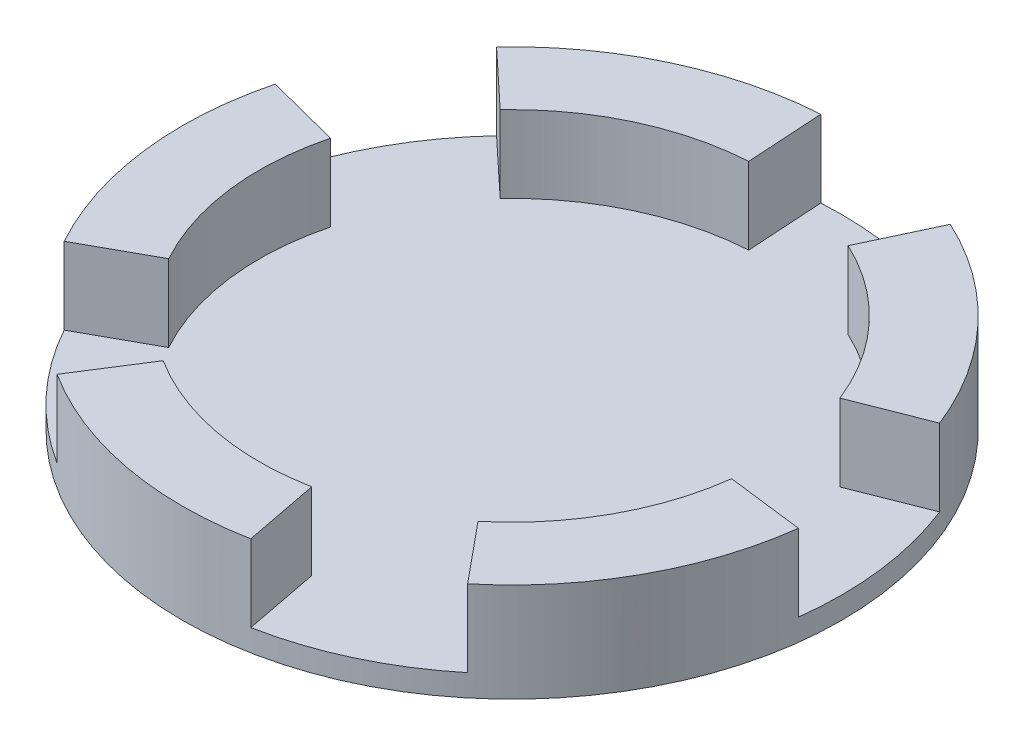
from build123d import *

# Parameters (mm, degrees)
SKETCH1_R           = 5
BOSS_EXTRUDE1_DEPTH = 7.75
SKETCH2_R           = 5
BOSS_EXTRUDE2_DEPTH = 5
SKETCH3_R           = 30
BOSS_EXTRUDE3_DEPTH = 2
FILLET1_R           = 6
BOSS_EXTRUDE4_DEPTH = 7
BOSS_EXTRUDE5_REACH = 49.677


with BuildPart() as part:
    # Sketch1 → Boss-Extrude1 (new body)
    with BuildSketch(Plane(origin=(0, 0, 0), x_dir=(1, 0, 0), z_dir=(0, 1, 0))):
        Circle(SKETCH1_R)
        with BuildLine():
            Line((-1.770593121, 2.575), (1.770593121, 2.575))
            ThreePointArc((1.770593121, 2.575), (0, -3.125), (-1.770593121, 2.575))
        make_face(mode=Mode.SUBTRACT)
    extrude(amount=BOSS_EXTRUDE1_DEPTH)

    # Sketch2 → Boss-Extrude2 (add)
    with BuildSketch(Plane(origin=(0, 7.75, 0), x_dir=(1, 0, 0), z_dir=(0, 1, 0))):
        Circle(SKETCH2_R)
    extrude(amount=BOSS_EXTRUDE2_DEPTH)

    # Sketch3 → Boss-Extrude3 (add)
    with BuildSketch(Plane(origin=(0, 12.75, 0), x_dir=(1, 0, 0), z_dir=(0, 1, 0))):
        Circle(SKETCH3_R)
    extrude(amount=BOSS_EXTRUDE3_DEPTH)

    # Fillet1
    fillet1_edges = [part.edges().sort_by_distance(p)[0] for p in [
        (-5, 12.75, 0),
    ]]
    fillet(fillet1_edges, radius=FILLET1_R)

    # Sketch4 → Boss-Extrude4 (add)
    with BuildSketch(Plane(origin=(0, 14.75, 0), x_dir=(1, 0, 0), z_dir=(0, 1, 0))):
        with BuildLine():
            Line((14.638601317, -17.740105735), (19.093827805, -23.13926835))
            ThreePointArc((19.093827805, -23.13926835), (26.293545079, -14.444704468), (29.770348498, -3.704908943))
            Line((29.770348498, -3.704908943), (22.823933849, -2.84043019))
            ThreePointArc((22.823933849, -2.84043019), (20.158384561, -11.074273425), (14.638601317, -17.740105735))
        make_face()
        with BuildLine():
            Line((21.39541974, 8.440143018), (27.907069226, 11.008882197))
            ThreePointArc((27.907069226, 11.008882197), (21.862882582, 20.542988225), (12.723121407, 27.168404106))
            Line((12.723121407, 27.168404106), (9.754393079, 20.829109814))
            ThreePointArc((9.754393079, 20.829109814), (16.761543313, 15.749624306), (21.39541974, 8.440143018))
        make_face()
        with BuildLine():
            Line((-1.415504714, 22.95640099), (-1.846310497, 29.943131726))
            ThreePointArc((-1.846310497, 29.943131726), (-12.781540551, 27.140969421), (-21.907027026, 20.495906101))
            Line((-21.907027026, 20.495906101), (-16.795387386, 15.713528011))
            ThreePointArc((-16.795387386, 15.713528011), (-9.799181089, 20.808076556), (-1.415504714, 22.95640099))
        make_face()
        with BuildLine():
            Line((-22.270249764, 5.747693053), (-29.048151867, 7.496990939))
            ThreePointArc((-29.048151867, 7.496990939), (-29.762309071, -3.768946635), (-26.262408702, -14.501237505))
            Line((-26.262408702, -14.501237505), (-20.134513338, -11.117615421))
            ThreePointArc((-20.134513338, -11.117615421), (-22.817770288, -2.889525753), (-22.270249764, 5.747693053))
        make_face()
        with BuildLine():
            Line((-12.348266578, -19.404131326), (-16.106434667, -25.309736512))
            ThreePointArc((-16.106434667, -25.309736512), (-5.612578038, -29.470306543), (5.675965822, -29.458163758))
            Line((5.675965822, -29.458163758), (4.351573797, -22.584592214))
            ThreePointArc((4.351573797, -22.584592214), (-4.302976496, -22.593901683), (-12.348266578, -19.404131326))
        make_face()
    extrude(amount=BOSS_EXTRUDE4_DEPTH)

    # Sketch5 → Boss-Extrude5 (add, up to next)
    with BuildSketch(Plane.XZ, mode=Mode.PRIVATE) as boss_extrude5_sk1:
        with BuildLine():
            ThreePointArc((-3.514921945, 3.556026395), (0.122828329, 4.998491092), (3.685339218, 3.379093791))
            Line((3.685339218, 3.379093791), (0.177057119, 7.205329583))
            Line((0.177057119, 7.205329583), (-3.514921945, 3.556026395))
        make_face()
    boss_extrude5_tool1 = extrude(boss_extrude5_sk1.sketch, amount=-BOSS_EXTRUDE5_REACH, mode=Mode.PRIVATE) - part.part
    # Sketch5 → Boss-Extrude5 (add, up to next)
    with BuildSketch(Plane.XZ, mode=Mode.PRIVATE) as boss_extrude5_sk2:
        with BuildLine():
            Line((6.783636057, 0), (3.685339218, 3.379093791))
            ThreePointArc((3.685339218, 3.379093791), (4.979319168, 0.454291346), (4.235990075, -2.656386283))
            Line((4.235990075, -2.656386283), (6.783636057, 0))
        make_face()
    boss_extrude5_tool2 = extrude(boss_extrude5_sk2.sketch, amount=-BOSS_EXTRUDE5_REACH, mode=Mode.PRIVATE) - part.part
    # Sketch5 → Boss-Extrude5 (add, up to next)
    with BuildSketch(Plane.XZ, mode=Mode.PRIVATE) as boss_extrude5_sk3:
        with BuildLine():
            ThreePointArc((-3.4609021, -3.608622542), (-4.999857886, -0.037697806), (-3.514921945, 3.556026395))
            Line((-3.514921945, 3.556026395), (-7.167204534, -0.054039174))
            Line((-7.167204534, -0.054039174), (-3.4609021, -3.608622542))
        make_face()
    boss_extrude5_tool3 = extrude(boss_extrude5_sk3.sketch, amount=-BOSS_EXTRUDE5_REACH, mode=Mode.PRIVATE) - part.part
    # Sketch5 → Boss-Extrude5 (add, up to next)
    with BuildSketch(Plane.XZ, mode=Mode.PRIVATE) as boss_extrude5_sk4:
        with BuildLine():
            ThreePointArc((2.831015746, -4.121328651), (-0.406086313, -4.983482107), (-3.4609021, -3.608622542))
            Line((-3.4609021, -3.608622542), (0.072600839, -6.997480037))
            Line((0.072600839, -6.997480037), (2.831015746, -4.121328651))
        make_face()
    boss_extrude5_tool4 = extrude(boss_extrude5_sk4.sketch, amount=-BOSS_EXTRUDE5_REACH, mode=Mode.PRIVATE) - part.part
    add(boss_extrude5_tool1.solids().sort_by_distance((0.135795, 0, 5.526169))[0])
    add(boss_extrude5_tool2.solids().sort_by_distance((5.435373, 0, 0.081741))[0])
    add(boss_extrude5_tool3.solids().sort_by_distance((-5.517001, 0, -0.041597))[0])
    add(boss_extrude5_tool4.solids().sort_by_distance((-0.022282, 0, -5.492268))[0])


solid = part.part
